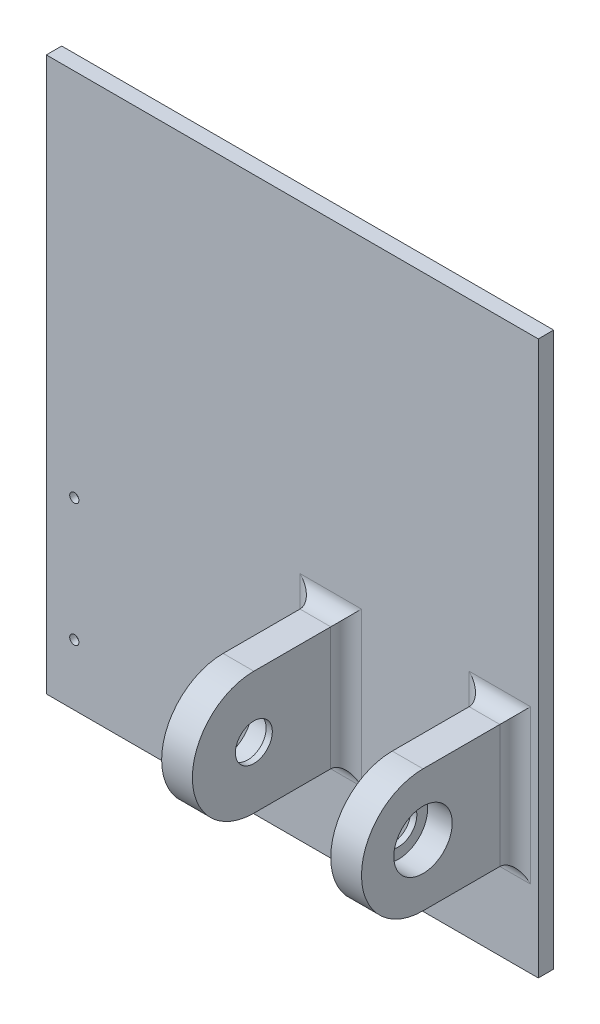
from build123d import *

# Parameters (mm, degrees)
SKETCH_2_W             = 160
SKETCH_2_H             = 180
EXTRUDE_1_DEPTH        = 5
SKETCH_3_W             = 10
SKETCH_3_H             = 40
EXTRUDE_2_DEPTH        = 35
SKETCH_4_R             = 20
EXTRUDE_3_DEPTH        = 10
SKETCH_5_R             = 9.5
CUT_EXTRUDE_1_DEPTH    = 8
SKETCH_13_R            = 6
CUT_EXTRUDE_2_DEPTH    = 150.995086454
FILLET_1_R             = 5
FILLET_1_OF_MIRROR_2_R = 5
SKETCH_14_R            = 1.5
CUT_EXTRUDE_3_DEPTH    = 10
SKETCH_15_R            = 2.85
CUT_EXTRUDE_4_DEPTH    = 3


with BuildPart() as part:
    # ｽｹｯﾁ2 → ﾎﾞｽ - 押し出し1 (new body)
    with BuildSketch(Plane.XY):
        with Locations((-40, 9.836245724)):
            Rectangle(SKETCH_2_W, SKETCH_2_H)
    extrude(amount=EXTRUDE_1_DEPTH)

    # ｽｹｯﾁ3 → ﾎﾞｽ - 押し出し2 (add)
    with BuildSketch(Plane.XY):
        with Locations((-27.5, -30)):
            Rectangle(SKETCH_3_W, SKETCH_3_H)
    extrude_2 = extrude(amount=EXTRUDE_2_DEPTH)

    # ｽｹｯﾁ4 → ﾎﾞｽ - 押し出し3 (add)
    with BuildSketch(Plane.ZY.offset(32.5)):
        with Locations((35, -30)):
            Circle(SKETCH_4_R)
    extrude_3 = extrude(amount=-EXTRUDE_3_DEPTH)

    # ｽｹｯﾁ5 → ｶｯﾄ - 押し出し1 (cut)
    with BuildSketch(Plane.ZY.offset(32.5)):
        with Locations((35, -30)):
            Circle(SKETCH_5_R)
    cut_extrude_1 = extrude(amount=-CUT_EXTRUDE_1_DEPTH, mode=Mode.SUBTRACT)

    # ｽｹｯﾁ13 → ｶｯﾄ - 押し出し2 (cut, through all)
    with BuildSketch(Plane(origin=(-22.5, 0, 0), x_dir=(0, 0, -1), z_dir=(1, 0, 0))):
        with Locations((-35, -30)):
            Circle(SKETCH_13_R)
    cut_extrude_2 = extrude(amount=-CUT_EXTRUDE_2_DEPTH, mode=Mode.SUBTRACT)

    # ﾌｨﾚｯﾄ1
    fillet_1_edges = [part.edges().sort_by_distance(p)[0] for p in [
        (-27.5, -50, 5),
        (-32.5, -30, 5),
        (-27.5, -10, 5),
        (-22.5, -30, 5),
    ]]
    fillet(fillet_1_edges, radius=FILLET_1_R)

    # ﾐﾗｰ2: ﾎﾞｽ - 押し出し2, ﾎﾞｽ - 押し出し3, ｶｯﾄ - 押し出し1, ｶｯﾄ - 押し出し2 across plane
    add(extrude_2.mirror(Plane(origin=(0, 0, 0), x_dir=(0, 0, 1), z_dir=(1, 0, 0))))
    add(extrude_3.mirror(Plane(origin=(0, 0, 0), x_dir=(0, 0, 1), z_dir=(1, 0, 0))))
    add(cut_extrude_1.mirror(Plane(origin=(0, 0, 0), x_dir=(0, 0, 1), z_dir=(1, 0, 0))), mode=Mode.SUBTRACT)
    add(cut_extrude_2.mirror(Plane(origin=(0, 0, 0), x_dir=(0, 0, 1), z_dir=(1, 0, 0))), mode=Mode.SUBTRACT)

    # ﾌｨﾚｯﾄ1 of ﾐﾗｰ2
    fillet_1_of_mirror_2_edges = [part.edges().sort_by_distance(p)[0] for p in [
        (27.5, -50, 5),
        (32.5, -30, 5),
        (27.5, -10, 5),
        (22.5, -30, 5),
    ]]
    fillet(fillet_1_of_mirror_2_edges, radius=FILLET_1_OF_MIRROR_2_R)

    # ｽｹｯﾁ14 → ｶｯﾄ - 押し出し3 (cut)
    with BuildSketch(Plane.XY):
        with Locations((-110.9, -20.35)):
            Circle(SKETCH_14_R)
        with Locations((-110.9, -60.35)):
            Circle(SKETCH_14_R)
    extrude(amount=CUT_EXTRUDE_3_DEPTH, mode=Mode.SUBTRACT)

    # ｽｹｯﾁ15 → ｶｯﾄ - 押し出し4 (cut)
    with BuildSketch(Plane.XY):
        with Locations((-110.9, -60.35)):
            Circle(SKETCH_15_R)
        Polygon((-113.75, -21.995448267), (-110.9, -23.640896534), (-108.05, -21.995448267), (-108.05, -18.704551733), (-110.9, -17.059103466), (-113.75, -18.704551733), align=None)
        Polygon((-113.75, -61.995448267), (-110.9, -63.640896534), (-108.05, -61.995448267), (-108.05, -58.704551733), (-110.9, -57.059103466), (-113.75, -58.704551733), align=None)
    extrude(amount=CUT_EXTRUDE_4_DEPTH, mode=Mode.SUBTRACT)


solid = part.part
